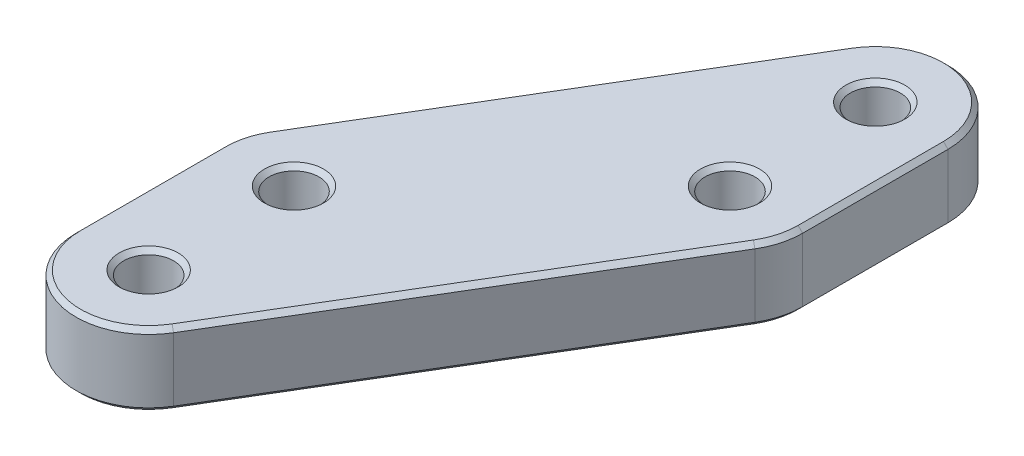
from build123d import *

# Parameters (mm, degrees)
SKETCH1_R           = 2.1828125
BOSS_EXTRUDE1_DEPTH = 3.175
CHAMFER1_SIZE       = 0.396875


with BuildPart() as part:
    # Sketch1 → Boss-Extrude1 (new, symmetric)
    with BuildSketch(Plane(origin=(0, 0, 0), x_dir=(1, 0, 0), z_dir=(0, 1, 0))):
        with BuildLine():
            Line((-25.4, -19.05), (-25.4, -31.75))
            ThreePointArc((-25.4, -31.75), (-20.745028245, -37.869589794), (-13.604919922, -35.017048047))
            Line((-13.604919922, -35.017048047), (5.445080078, -3.267048047))
            ThreePointArc((5.445080078, -3.267048047), (6.119589794, -1.695028245), (6.35, 0))
            Line((6.35, 0), (6.35, 12.7))
            ThreePointArc((6.35, 12.7), (1.695028245, 18.819589794), (-5.445080078, 15.967048047))
            Line((-5.445080078, 15.967048047), (-24.495080078, -15.782951953))
            ThreePointArc((-24.495080078, -15.782951953), (-25.169589794, -17.354971755), (-25.4, -19.05))
        make_face()
        Circle(SKETCH1_R, mode=Mode.SUBTRACT)
        with Locations((0, 12.7)):
            Circle(SKETCH1_R, mode=Mode.SUBTRACT)
        with Locations((-19.05, -19.05)):
            Circle(SKETCH1_R, mode=Mode.SUBTRACT)
        with Locations((-19.05, -31.75)):
            Circle(SKETCH1_R, mode=Mode.SUBTRACT)
    extrude(amount=BOSS_EXTRUDE1_DEPTH, both=True)

    # Chamfer1
    chamfer1_edges = [part.edges().sort_by_distance(p)[0] for p in [
        (-21.2328125, -3.175, 31.75),
        (-21.2328125, -3.175, 19.05),
        (-2.1828125, -3.175, -12.7),
        (-2.1828125, -3.175, 0),
        (-25.4, -3.175, 25.4),
        (-20.745028245, -3.175, 37.869589794),
        (-4.079919922, -3.175, 19.142048047),
        (6.119589794, -3.175, 1.695028245),
        (1.695028245, -3.175, -18.819589794),
        (-14.970080078, -3.175, -0.092048047),
        (-25.169589794, -3.175, 17.354971755),
        (-21.2328125, 3.175, 31.75),
        (-2.1828125, 3.175, -12.7),
        (-14.970080078, 3.175, -0.092048047),
        (1.695028245, 3.175, -18.819589794),
        (6.119589794, 3.175, 1.695028245),
        (-4.079919922, 3.175, 19.142048047),
        (-20.745028245, 3.175, 37.869589794),
        (-25.4, 3.175, 25.4),
        (-25.169589794, 3.175, 17.354971755),
        (-2.1828125, 3.175, 0),
        (-21.2328125, 3.175, 19.05),
        (6.35, -3.175, -6.35),
        (6.35, 3.175, -6.35),
    ]]
    chamfer(chamfer1_edges, length=CHAMFER1_SIZE)


solid = part.part
